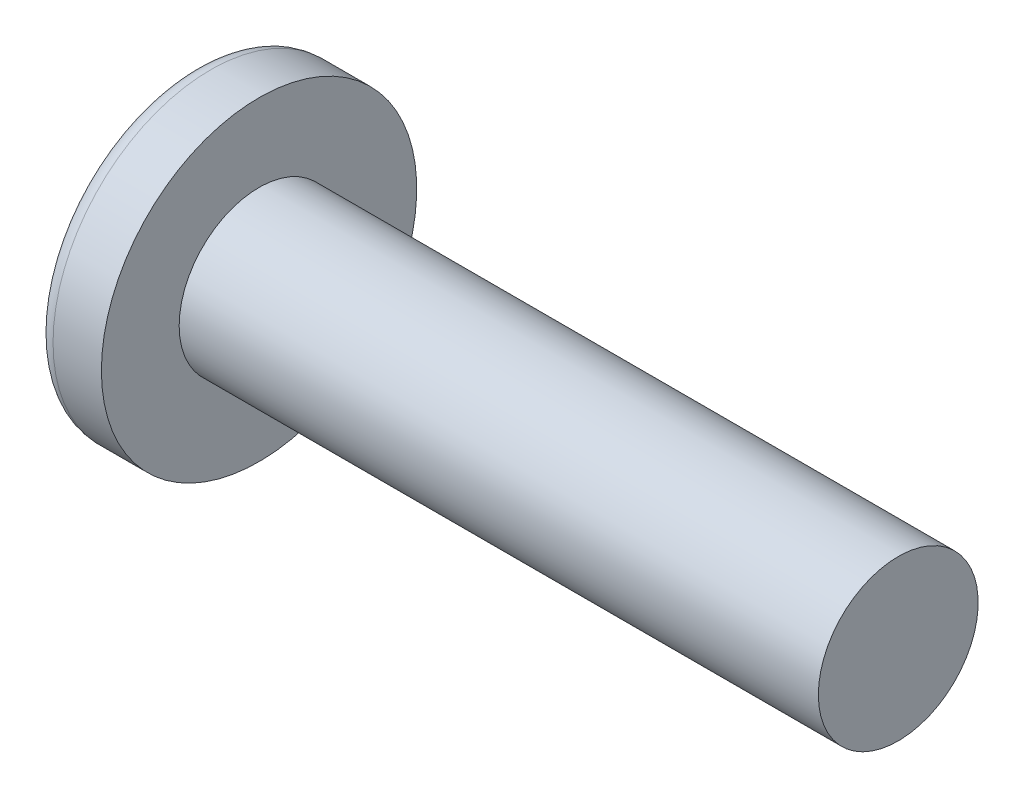
from build123d import *

# Parameters (mm, degrees)
CIRPATTERN1_COUNT = 2
CIRPATTERN1_ANGLE = 90


with BuildPart() as part:
    # BodySke → Base-Revolve (revolve)
    with BuildSketch(Plane.XY):
        with BuildLine():
            Line((6.6294, 4.7625), (6.6294, 9.398))
            Line((6.6294, 9.398), (3.748078838, 9.398))
            ThreePointArc((3.748078838, 9.398), (3.287664738, 9.287690266), (2.927227326, 8.980714286))
            ThreePointArc((2.927227326, 8.980714286), (0.750275097, 4.72286695), (0, 0))
            Line((0, 0), (44.7294, 0))
            Line((44.7294, 0), (44.7294, 4.7625))
            Line((44.7294, 4.7625), (6.6294, 4.7625))
        make_face()
    revolve(axis=Axis((-25.4, 0, 0), (1, 0, 0)))

    # Sketch3 → Cut-Loft1 section 0
    with BuildSketch(Plane(origin=(0, 0, 0), x_dir=(0, 0, -1), z_dir=(1, 0, 0))):
        with BuildLine():
            Line((1.0287, -6.096), (-1.0287, -6.096))
            Line((-1.0287, -6.096), (-1.0287, 6.096))
            Line((-1.0287, 6.096), (1.0287, 6.096))
            Line((1.0287, 6.096), (1.0287, -6.096))
        make_face()
    # Sketch4 → Cut-Loft1 section 1
    with BuildSketch(Plane(origin=(7.2644, 0, 0), x_dir=(0, 0, -1), z_dir=(1, 0, 0))):
        with BuildLine():
            Line((0.51435, -0.51435), (-0.51435, -0.51435))
            Line((-0.51435, -0.51435), (-0.51435, 0.51435))
            Line((-0.51435, 0.51435), (0.51435, 0.51435))
            Line((0.51435, 0.51435), (0.51435, -0.51435))
        make_face()
    cut_loft1 = loft(mode=Mode.SUBTRACT)

    # CirPattern1: Cut-Loft1 ×2 about axis
    cirpattern1_axis = Axis((-25.4, 0, 0), (1, 0, 0))
    for i in range(1, CIRPATTERN1_COUNT):
        add(cut_loft1.rotate(cirpattern1_axis, i * CIRPATTERN1_ANGLE / (CIRPATTERN1_COUNT - 1)), mode=Mode.SUBTRACT)


solid = part.part
